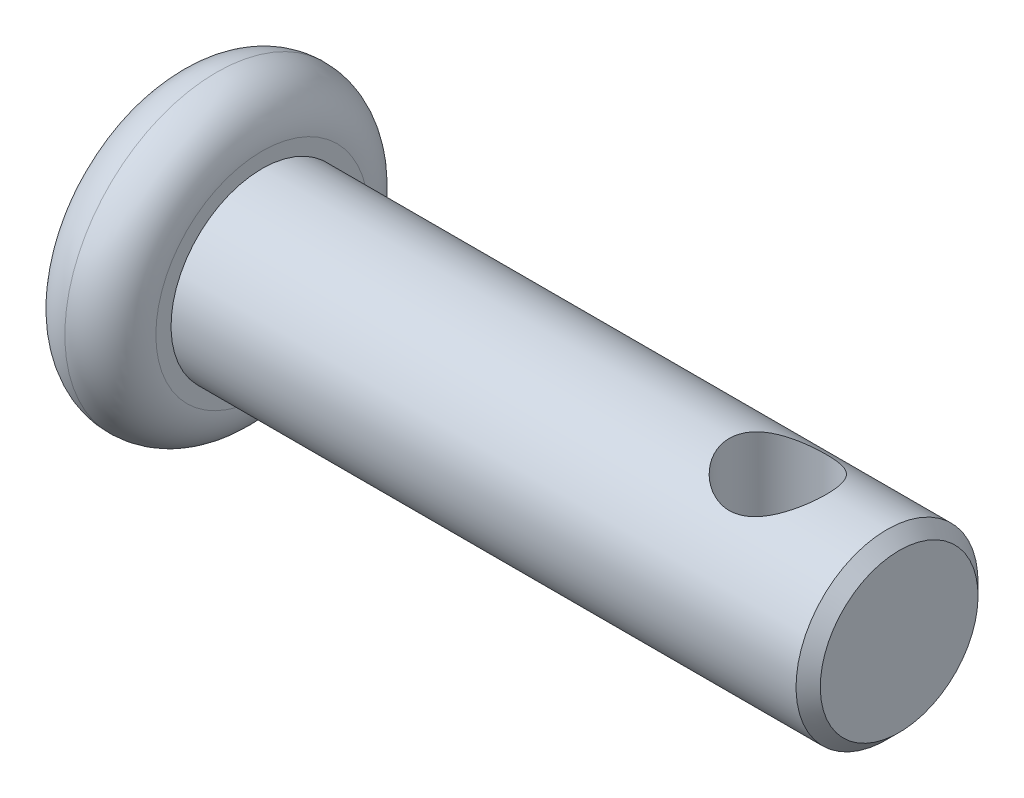
from build123d import *

# Parameters (mm, degrees)
SKETCH_2_R          = 0.8
CUT_EXTRUDE_1_DEPTH = 10
CHAMFER_1_SIZE      = 0.2
FILLET_1_R          = 0.75


with BuildPart() as part:
    # 草图1 → 旋转1 (revolve)
    with BuildSketch(Plane.XY):
        Polygon((0, 0), (0, 2.5), (1.5, 2.5), (1.5, 1.5), (12, 1.5), (12, 0), align=None)
    revolve(axis=Axis((12, 0, 0), (-1, 0, 0)))

    # 草图2 → 切除-拉伸1 (cut, symmetric)
    with BuildSketch(Plane(origin=(0, 0, 0), x_dir=(1, 0, 0), z_dir=(0, 1, 0))):
        with Locations(Location((10, 0, 0), (0, 0, 270))):
            Circle(SKETCH_2_R)
    extrude(amount=CUT_EXTRUDE_1_DEPTH, both=True, mode=Mode.SUBTRACT)

    # 倒角1
    chamfer_1_edges = [part.edges().sort_by_distance(p)[0] for p in [
        (12, -1.5, 0),
    ]]
    chamfer(chamfer_1_edges, length=CHAMFER_1_SIZE)

    # 圆角1
    fillet_1_edges = [part.edges().sort_by_distance(p)[0] for p in [
        (1.5, -2.5, 0),
        (0, -2.5, 0),
    ]]
    fillet(fillet_1_edges, radius=FILLET_1_R - 0.0001)  # a hair under: the kernel refuses the full size


solid = part.part
